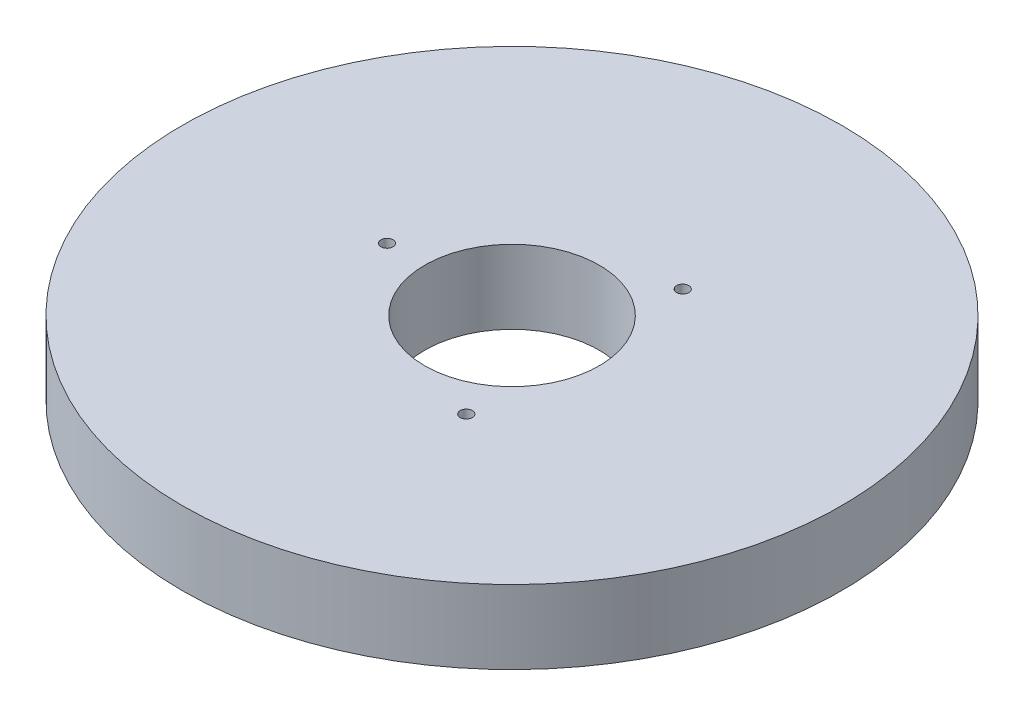
from build123d import *

# Parameters (mm, degrees)
SKETCH1_R           = 85
BOSS_EXTRUDE1_DEPTH = 19
SKETCH2_R           = 22.5
CUT_EXTRUDE1_DEPTH  = 122.70045193
SKETCH3_R           = 1.567329789
CUT_EXTRUDE2_DEPTH  = 13.772674953
CIRPATTERN1_COUNT   = 3


with BuildPart() as part:
    # Sketch1 → Boss-Extrude1 (new body)
    with BuildSketch(Plane(origin=(0, 0, 0), x_dir=(1, 0, 0), z_dir=(0, 1, 0))):
        Circle(SKETCH1_R)
    extrude(amount=BOSS_EXTRUDE1_DEPTH)

    # Sketch2 → Cut-Extrude1 (cut, through all)
    with BuildSketch(Plane(origin=(0, 0, 0), x_dir=(1, 0, 0), z_dir=(0, 1, 0))):
        Circle(SKETCH2_R)
    extrude(amount=CUT_EXTRUDE1_DEPTH, mode=Mode.SUBTRACT)

    # Sketch3 → Cut-Extrude2 (cut)
    with BuildSketch(Plane(origin=(0, 19, 0), x_dir=(1, 0, 0), z_dir=(0, 1, 0))):
        with Locations((-32.23541133, 0)):
            Circle(SKETCH3_R)
    cut_extrude2 = extrude(amount=-CUT_EXTRUDE2_DEPTH, mode=Mode.SUBTRACT)

    # CirPattern1: Cut-Extrude2 ×3 about axis
    cirpattern1_axis = Axis((0, 0, 0), (0, 1, 0))
    for i in range(1, CIRPATTERN1_COUNT):
        add(cut_extrude2.rotate(cirpattern1_axis, i * 360 / CIRPATTERN1_COUNT), mode=Mode.SUBTRACT)


solid = part.part
